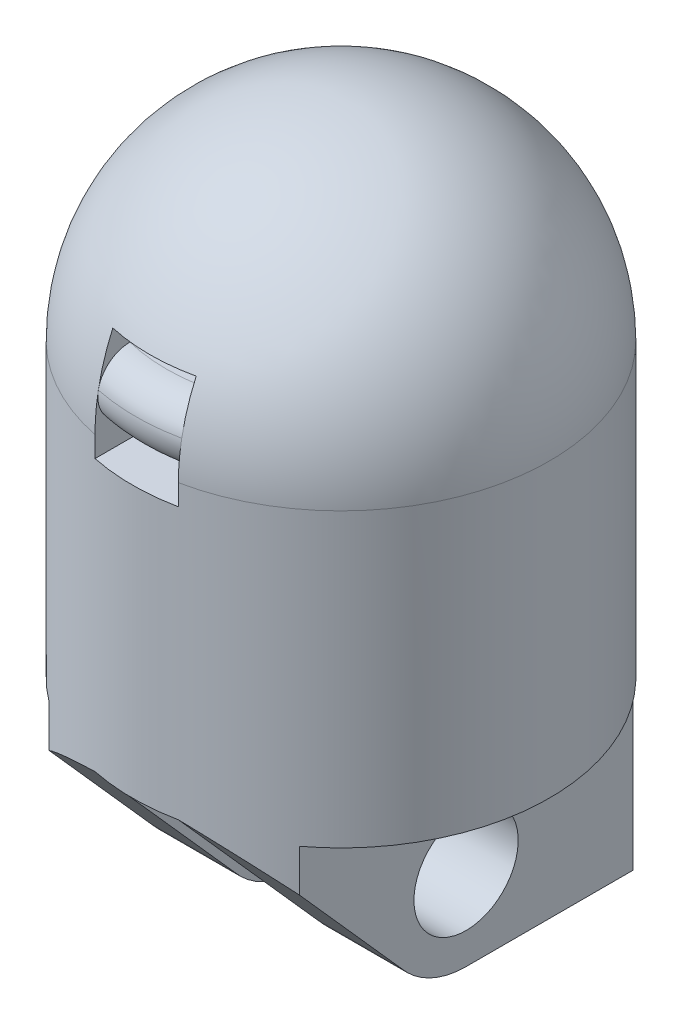
from build123d import *

# Parameters (mm, degrees)
CUT_EXTRUDE1_DEPTH      = 11.43
SKETCH3_R               = 3.175
CUT_EXTRUDE2_DEPTH      = 49.276707634
CUT_EXTRUDE3_DEPTH      = 47.368046109
CUT_EXTRUDE3_DEPTH_BACK = 47.368046109
CUT_EXTRUDE5_DEPTH      = 46.5963606
CUT_EXTRUDE5_DEPTH_BACK = 46.5963606
SKETCH7_W               = 5.08
SKETCH7_H               = 1.27
FILLET1_R               = 1.905


with BuildPart() as part:
    # Sketch1 → Revolve1 (revolve)
    with BuildSketch(Plane.XY):
        with BuildLine():
            Line((0, 0), (0, 5.602635041))
            Line((0, 5.602635041), (-2.54, 5.602635041))
            Line((-2.54, 5.602635041), (-2.54, 22.86))
            ThreePointArc((-2.54, 22.86), (-6.715756159, 30.503336463), (0, 36.049159305))
            Line((0, 36.049159305), (0, 41.91))
            ThreePointArc((0, 41.91), (-8.980256121, 38.190256121), (-12.7, 29.21))
            Line((-12.7, 29.21), (-12.7, 0))
            Line((-12.7, 0), (0, 0))
        make_face()
    revolve(axis=Axis((0, 0, 0), (0, 1, 0)))

    # Sketch2 → Cut-Extrude1 (cut)
    with BuildSketch(Plane.XZ):
        with BuildLine():
            Line((-2.54, 12.443407893), (-2.54, -12.443407893))
            ThreePointArc((-2.54, -12.443407893), (0, -12.7), (2.54, -12.443407893))
            Line((2.54, -12.443407893), (2.54, 12.443407893))
            ThreePointArc((2.54, 12.443407893), (0, 12.7), (-2.54, 12.443407893))
        make_face()
        with BuildLine():
            Line((-7.62, 10.16), (-7.62, -10.16))
            ThreePointArc((-7.62, -10.16), (-12.7, 0), (-7.62, 10.16))
        make_face()
        with BuildLine():
            Line((7.62, 10.16), (7.62, -10.16))
            ThreePointArc((7.62, -10.16), (12.7, 0), (7.62, 10.16))
        make_face()
    extrude(amount=-CUT_EXTRUDE1_DEPTH, mode=Mode.SUBTRACT)

    # Sketch3 → Cut-Extrude2 (cut, through all)
    with BuildSketch(Plane.ZY.offset(7.62)):
        with Locations((0, 5.08)):
            Circle(SKETCH3_R)
    extrude(amount=-CUT_EXTRUDE2_DEPTH, mode=Mode.SUBTRACT)

    # Sketch4 → Cut-Extrude3 (cut, two sides: drawn at the far end of the back side and taken through both)
    with BuildSketch(Plane(origin=(-2.54, 0, 0), x_dir=(0, 0, -1), z_dir=(1, 0, 0)).offset(-CUT_EXTRUDE3_DEPTH_BACK)):
        with BuildLine():
            Line((-12.443407893, 11.43), (-3.94133892, 1.874965286))
            ThreePointArc((-3.94133892, 1.874965286), (-2.182295082, 0.492627313), (0, 0))
            Line((0, 0), (-12.443407893, 0))
            Line((-12.443407893, 0), (-12.443407893, 11.43))
        make_face()
    extrude(amount=CUT_EXTRUDE3_DEPTH + CUT_EXTRUDE3_DEPTH_BACK, mode=Mode.SUBTRACT)

    # Sketch7 → Cut-Extrude5 (cut, two sides: drawn at the far end of the back side and taken through both)
    with BuildSketch(Plane.XY.offset(-CUT_EXTRUDE5_DEPTH_BACK)):
        with Locations((0, 28.575)):
            Rectangle(SKETCH7_W, SKETCH7_H)
        with Locations((0, 33.655)):
            Rectangle(SKETCH7_W, SKETCH7_H)
    extrude(amount=CUT_EXTRUDE5_DEPTH + CUT_EXTRUDE5_DEPTH_BACK, mode=Mode.SUBTRACT)

    # Fillet1
    # the kernel refuses this fillet: 1.905 mm, written as the material it takes off along each edge
    with BuildSketch(Plane(origin=(0, 29.21, 0), x_dir=(-0.6006287696946588, 0, 0.7995280364159099), z_dir=(-0.7995280364159099, 0, -0.6006287696946588))) as fillet1_piece_1_section:
        with BuildLine():
            CenterArc((10.625582337, 1.905), FILLET1_R, 270, 100.164248622)
            Line((10.625582337, 0), (12.7, 0))
            ThreePointArc((12.7, 0), (12.650073138, 1.125010933), (12.500685102, 2.241176471))
        make_face()
    fillet1_piece_1 = revolve(axis=Axis((0, 29.21, 0), (0, 1, 0)), revolution_arc=73.829886486, mode=Mode.PRIVATE)
    fillet1_piece_1 = split(fillet1_piece_1, bisect_by=Plane(origin=(2.54, 29.726908465, 12.1243087), z_dir=(-1, 0, 0)), keep=Keep.TOP, mode=Mode.PRIVATE)
    fillet1_piece_1 = split(fillet1_piece_1, bisect_by=Plane(origin=(-2.54, 29.726908465, 12.1243087), z_dir=(1, 0, 0)), keep=Keep.TOP, mode=Mode.PRIVATE)
    add(fillet1_piece_1, mode=Mode.SUBTRACT)
    with BuildSketch(Plane(origin=(0, 33.02, 0), x_dir=(0.5180820301307637, 0, 0.8553309359865259), z_dir=(0.8553309359865259, 0, -0.5180820301307637))) as fillet1_piece_2_section:
        with BuildLine():
            CenterArc((10.625582337, 1.905), FILLET1_R, 270, 79.835751378)
            Line((10.625582337, 0), (12.115027858, 0))
            ThreePointArc((12.115027858, 0), (12.332827452, 0.778273257), (12.500685102, 1.568823529))
        make_face()
    fillet1_piece_2 = revolve(axis=Axis((0, 33.02, 0), (0, -1, 0)), revolution_arc=62.407371172, mode=Mode.PRIVATE)
    fillet1_piece_2 = split(fillet1_piece_2, bisect_by=Plane(origin=(-2.54, 32.67222625, 11.799196002), z_dir=(1, 0, 0)), keep=Keep.TOP, mode=Mode.PRIVATE)
    fillet1_piece_2 = split(fillet1_piece_2, bisect_by=Plane(origin=(2.54, 32.67222625, 11.799196002), z_dir=(-1, 0, 0)), keep=Keep.TOP, mode=Mode.PRIVATE)
    add(fillet1_piece_2, mode=Mode.SUBTRACT)
    with BuildSketch(Plane(origin=(0, 33.02, 0), x_dir=(-0.5180820301307628, 0, -0.8553309359865263), z_dir=(-0.8553309359865263, 0, 0.5180820301307628))) as fillet1_piece_3_section:
        with BuildLine():
            CenterArc((10.625582337, 1.905), FILLET1_R, 270, 79.835751378)
            Line((10.625582337, 0), (12.115027858, 0))
            ThreePointArc((12.115027858, 0), (12.332827452, 0.778273257), (12.500685102, 1.568823529))
        make_face()
    fillet1_piece_3 = revolve(axis=Axis((0, 33.02, 0), (0, -1, 0)), revolution_arc=62.407371172, mode=Mode.PRIVATE)
    fillet1_piece_3 = split(fillet1_piece_3, bisect_by=Plane(origin=(-2.54, 32.67222625, -11.799196002), z_dir=(1, 0, 0)), keep=Keep.TOP, mode=Mode.PRIVATE)
    fillet1_piece_3 = split(fillet1_piece_3, bisect_by=Plane(origin=(2.54, 32.67222625, -11.799196002), z_dir=(-1, 0, 0)), keep=Keep.TOP, mode=Mode.PRIVATE)
    add(fillet1_piece_3, mode=Mode.SUBTRACT)
    with BuildSketch(Plane(origin=(0, 29.21, 0), x_dir=(0.6006287696946002, 0, -0.7995280364159538), z_dir=(0.7995280364159538, 0, 0.6006287696946002))) as fillet1_piece_4_section:
        with BuildLine():
            CenterArc((10.625582337, 1.905), FILLET1_R, 270, 100.164248622)
            Line((10.625582337, 0), (12.7, 0))
            ThreePointArc((12.7, 0), (12.650073138, 1.125010933), (12.500685102, 2.241176471))
        make_face()
    fillet1_piece_4 = revolve(axis=Axis((0, 29.21, 0), (0, 1, 0)), revolution_arc=73.829886486, mode=Mode.PRIVATE)
    fillet1_piece_4 = split(fillet1_piece_4, bisect_by=Plane(origin=(-2.54, 29.726908465, -12.1243087), z_dir=(1, 0, 0)), keep=Keep.TOP, mode=Mode.PRIVATE)
    fillet1_piece_4 = split(fillet1_piece_4, bisect_by=Plane(origin=(2.54, 29.726908465, -12.1243087), z_dir=(-1, 0, 0)), keep=Keep.TOP, mode=Mode.PRIVATE)
    add(fillet1_piece_4, mode=Mode.SUBTRACT)


solid = part.part
